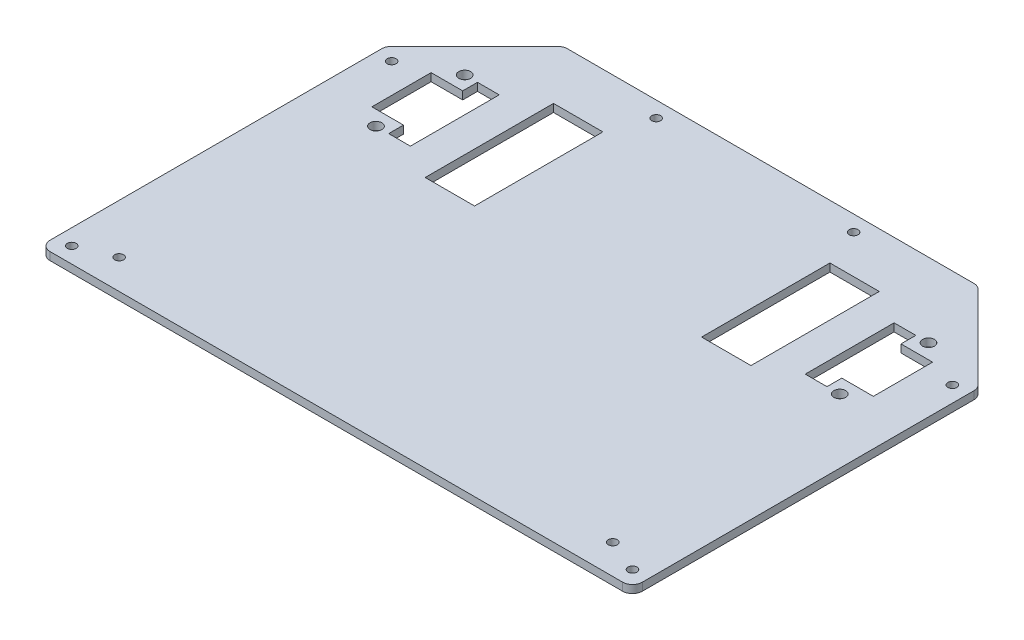
from build123d import *

# Parameters (mm, degrees)
MAIN_EXTRUSION_DEPTH    = 4
CORNER_LEAVE_R          = 5
ESQUISSE2_R             = 3
ESQUISSE2_W             = 25
ESQUISSE2_H             = 65
ENL_V_MAT_EXTRU_1_DEPTH = 267.30058205
D_GAGEMENT_M41_D        = 4.5
D_GAGEMENT_M42_D        = 4.5


with BuildPart() as part:
    # Main scetch → Main extrusion (new body)
    with BuildSketch(Plane(origin=(0, 0, 0), x_dir=(1, 0, 0), z_dir=(0, 1, 0))):
        Polygon((-150, 0), (150, 0), (150, 175), (105, 220), (-105, 220), (-150, 175), align=None)
    extrude(amount=MAIN_EXTRUSION_DEPTH)

    # Corner leave
    corner_leave_edges = [part.edges().sort_by_distance(p)[0] for p in [
        (-150, 2, 0),
        (150, 2, -175),
        (105, 2, -220),
        (150, 2, 0),
        (-105, 2, -220),
        (-150, 2, -175),
    ]]
    fillet(corner_leave_edges, radius=CORNER_LEAVE_R)

    # Esquisse2 → Enlèv. mat.-Extru.1 (cut, through all)
    with BuildSketch(Plane(origin=(0, 4, 0), x_dir=(1, 0, 0), z_dir=(0, 1, 0))):
        with Locations((117.47, 182.47)):
            Circle(ESQUISSE2_R)
        with Locations((117.47, 137.53)):
            Circle(ESQUISSE2_R)
        with Locations((-117.47, 137.53)):
            Circle(ESQUISSE2_R)
        with Locations((-117.47, 182.47)):
            Circle(ESQUISSE2_R)
        with Locations((70, 160)):
            Rectangle(ESQUISSE2_W, ESQUISSE2_H)
        Polygon((100, 137.5), (100, 182.5), (111, 182.5), (111, 175), (127, 175), (127, 145), (111, 145), (111, 137.5), align=None)
        Polygon((-111, 137.5), (-111, 145), (-127, 145), (-127, 175), (-111, 175), (-111, 182.5), (-100, 182.5), (-100, 137.5), align=None)
        with Locations((-70, 160)):
            Rectangle(ESQUISSE2_W, ESQUISSE2_H)
    extrude(amount=-ENL_V_MAT_EXTRU_1_DEPTH, mode=Mode.SUBTRACT)

    # Dégagement M41 (through all)
    with Locations(Plane(origin=(0, 4, 0), x_dir=(1, 0, 0), z_dir=(0, 1, 0))):
        with Locations((-125, 15), (125, 15)):
            Hole(D_GAGEMENT_M41_D / 2)

    # Dégagement M42 (through all)
    with Locations(Plane(origin=(-142, 4, -8), x_dir=(0, 0, 1), z_dir=(0, 1, 0))):
        with Locations((0, 0), (-162, 0), (-204, 92), (-204, 192), (-162, 284), (0, 284)):
            Hole(D_GAGEMENT_M42_D / 2)


solid = part.part
